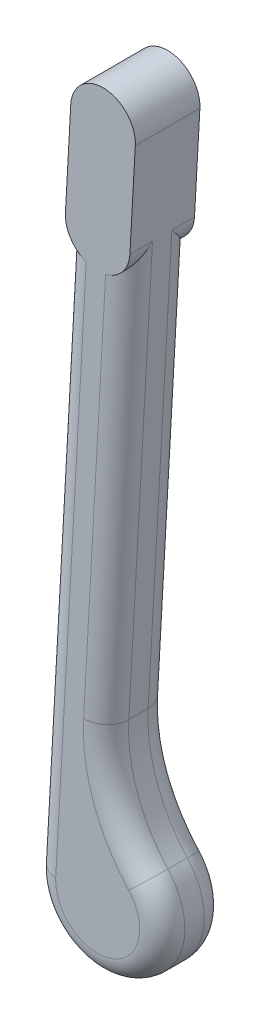
from build123d import *

# Parameters (mm, degrees)
EXTRUDE_1_DEPTH = 20
FILLET_1_R      = 7
EXTRUDE_2_DEPTH = 20


with BuildPart() as part:
    # 草图1 → 凸台-拉伸1 (new body)
    with BuildSketch(Plane.XY):
        with BuildLine():
            Line((-9.984555975, 0.555555556), (-19.969111951, -178.888888889))
            ThreePointArc((-19.969111951, -178.888888889), (6.717955109, -198.837969083), (14.759919727, -166.503897983))
            ThreePointArc((14.759919727, -166.503897983), (5.273090806, -150.735790608), (2.641695759, -132.52291348))
            Line((2.641695759, -132.52291348), (9.984555975, -0.555555556))
            ThreePointArc((9.984555975, -0.555555556), (0.555555556, 9.984555975), (-9.984555975, 0.555555556))
        make_face()
    extrude(amount=EXTRUDE_1_DEPTH)

    # 圆角1
    fillet_1_edges = [part.edges().sort_by_distance(p)[0] for p in [
        (-14.976833963, -89.166666667, 0),
        (0.555555556, 9.984555975, 0),
        (6.313125867, -66.539234518, 0),
        (5.273090806, -150.735790608, 0),
        (-14.976833963, -89.166666667, 20),
        (0.555555556, 9.984555975, 20),
        (6.313125867, -66.539234518, 20),
        (5.273090806, -150.735790608, 20),
        (6.717955109, -198.837969083, 0),
        (6.717955109, -198.837969083, 20),
    ]]
    fillet(fillet_1_edges, radius=FILLET_1_R)

    # 草图2 → 凸台-拉伸2 (add)
    with BuildSketch(Plane.XY):
        with BuildLine():
            Line((-9.984555975, 0.555555556), (-8.317889309, 30.509223482))
            ThreePointArc((-8.317889309, 30.509223482), (2.222222222, 39.938223901), (11.651222642, 29.39811237))
            Line((11.651222642, 29.39811237), (9.984555975, -0.555555556))
            ThreePointArc((9.984555975, -0.555555556), (-0.555555556, -9.984555975), (-9.984555975, 0.555555556))
        make_face()
    extrude(amount=EXTRUDE_2_DEPTH)


solid = part.part
